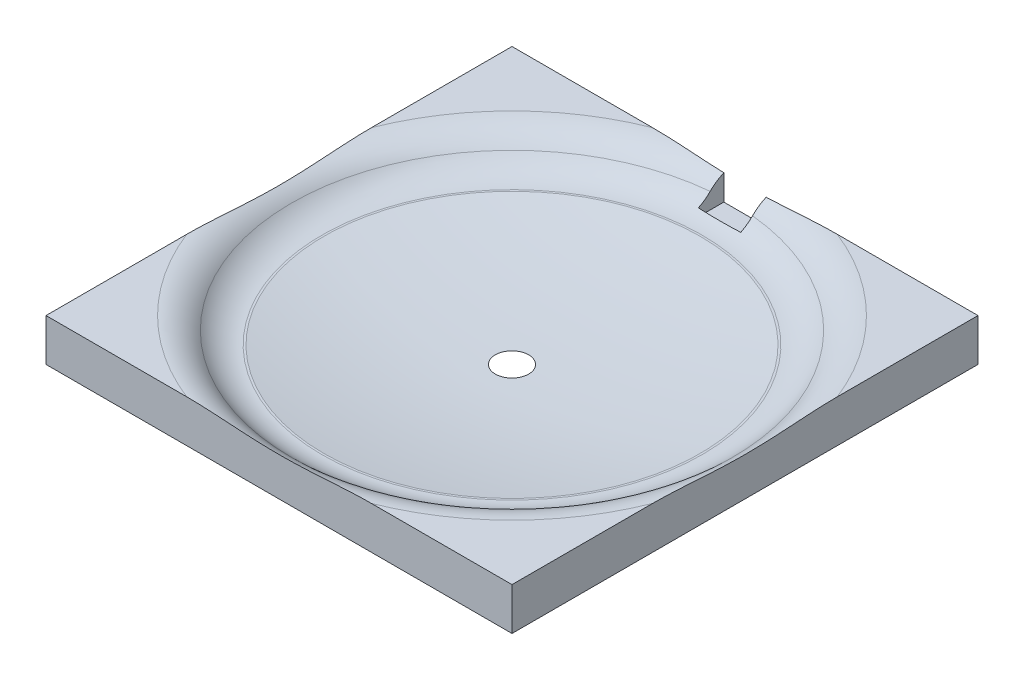
from build123d import *

# Parameters (mm, degrees)
SKETCH1_W           = 110
SKETCH1_H           = 110
BOSS_EXTRUDE1_DEPTH = 10
SKETCH2_R           = 50
CUT_EXTRUDE1_DEPTH  = 6
FILLET1_R           = 10
FILLET2_R           = 10
SKETCH4_W           = 10
SKETCH4_H           = 6
CUT_EXTRUDE2_DEPTH  = 6


with BuildPart() as part:
    # Sketch1 → Boss-Extrude1 (new body)
    with BuildSketch(Plane(origin=(0, 0, 0), x_dir=(1, 0, 0), z_dir=(0, 1, 0))):
        Rectangle(SKETCH1_W, SKETCH1_H)
    extrude(amount=BOSS_EXTRUDE1_DEPTH)

    # Sketch2 → Cut-Extrude1 (cut)
    with BuildSketch(Plane(origin=(0, 10, 0), x_dir=(1, 0, 0), z_dir=(0, 1, 0))):
        with Locations(Location((0, 0, 0), (0, 0, 270))):
            Circle(SKETCH2_R)
    extrude(amount=-CUT_EXTRUDE1_DEPTH, mode=Mode.SUBTRACT)

    # Fillet1
    # the kernel refuses this fillet: 10 mm, written as the material it takes off along each edge
    with BuildSketch(Plane(origin=(0, 10, 0), x_dir=(0, 0, 1), z_dir=(-1, 0, 0))) as fillet1_piece_1:
        with BuildLine():
            CenterArc((59.16515139, -10), FILLET1_R, 90, 66.421821522)
            Line((50, -6), (50, 0))
            Line((50, 0), (59.16515139, 0))
        make_face()
    revolve(axis=Axis((0, 10, 0), (0, 1, 0)), mode=Mode.SUBTRACT)

    # Fillet2
    fillet2_edges = [part.edges().sort_by_distance(p)[0] for p in [
        (0, 4, -50),
    ]]
    fillet(fillet2_edges, radius=FILLET2_R)

    # Sketch3 → Cut-Revolve3 (revolve, cut)
    with BuildSketch(Plane(origin=(0, 0, 0), x_dir=(0, 0, -1), z_dir=(1, 0, 0)), mode=Mode.PRIVATE) as cut_revolve3_sk:
        with BuildLine():
            Line((0, 0), (0, 10.285805254))
            Line((0, 10.285805254), (-44.639424331, 4.043757306))
            add(Edge.make_bspline(
                [(0, 0), (-22.429529075, -0.19444877), (-44.639424331, 4.043757306)],
                knots=[0, 0, 0, 1, 1, 1], degree=2))
        make_face()
    revolve(cut_revolve3_sk.sketch.rotate(Axis((0, 0, 0), (0, 1, 0)), 180), axis=Axis((0, 0, 0), (0, 1, 0)), mode=Mode.SUBTRACT)

    # Sketch4 → Cut-Extrude2 (cut)
    with BuildSketch(Plane(origin=(0, 0, -55), x_dir=(-1, 0, 0), z_dir=(0, 0, -1))):
        with Locations((0, 6.191841145)):
            Rectangle(SKETCH4_W, SKETCH4_H)
    extrude(amount=-CUT_EXTRUDE2_DEPTH, mode=Mode.SUBTRACT)


solid = part.part
